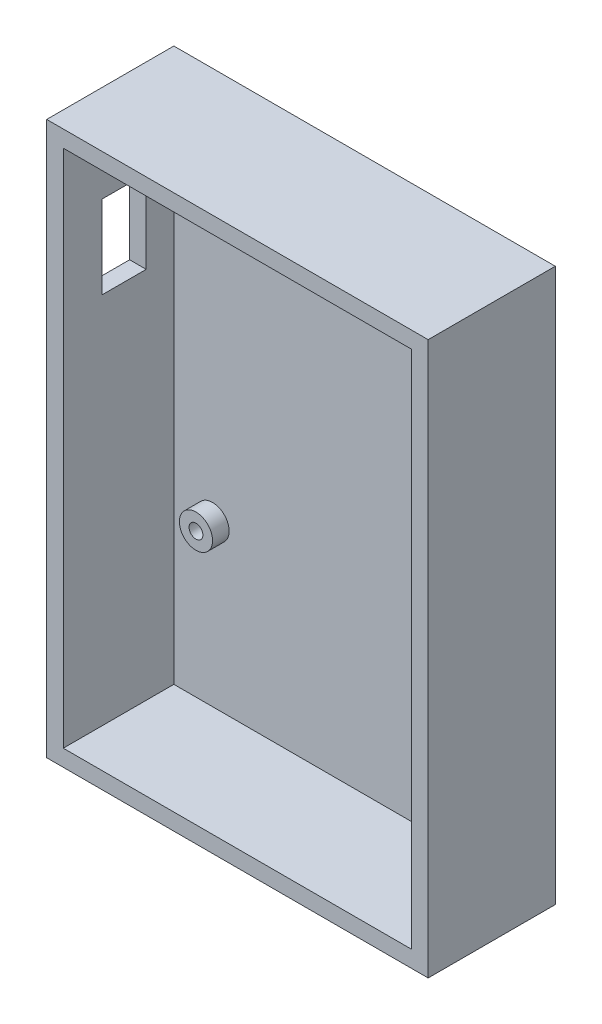
from build123d import *

# Parameters (mm, degrees)
IZIM1_W                     = 69
IZIM1_H                     = 100
IZIM1_R                     = 3
Y_KSEKLIK_EKSTR_ZYON1_DEPTH = 3
IZIM2_R                     = 3
IZIM2_R_2                   = 1.25
Y_KSEKLIK_EKSTR_ZYON2_DEPTH = 3
IZIM3_W                     = 69
IZIM3_H                     = 100
IZIM3_W_2                   = 63
IZIM3_H_2                   = 94
Y_KSEKLIK_EKSTR_ZYON3_DEPTH = 20
IZIM5_W                     = 8
IZIM5_H                     = 15
KES_EKSTR_ZYON1_DEPTH       = 10


with BuildPart() as part:
    # Çizim1 → Yükseklik-Ekstrüzyon1 (new body)
    with BuildSketch(Plane.XY):
        Rectangle(IZIM1_W, IZIM1_H)
        with Locations((0, 31.580483241)):
            Circle(IZIM1_R, mode=Mode.SUBTRACT)
    extrude(amount=Y_KSEKLIK_EKSTR_ZYON1_DEPTH)

    # Çizim2 → Yükseklik-Ekstrüzyon2 (add)
    # profile 1 of 4: a face of its own
    with BuildSketch(Plane.XY.offset(3)):
        with Locations((-24.5, 40)):
            Circle(IZIM2_R)
        with Locations((-24.5, 40)):
            Circle(IZIM2_R_2, mode=Mode.SUBTRACT)
    # profile 2 of 4: a face of its own
    with BuildSketch(Plane.XY.offset(3)):
        with Locations((24.5, 40)):
            Circle(IZIM2_R)
        with Locations((24.5, 40)):
            Circle(IZIM2_R_2, mode=Mode.SUBTRACT)
    # profile 3 of 4: a face of its own
    with BuildSketch(Plane.XY.offset(3)):
        with Locations((24.5, -18)):
            Circle(IZIM2_R)
        with Locations((24.5, -18)):
            Circle(IZIM2_R_2, mode=Mode.SUBTRACT)
    # profile 4 of 4: a face of its own
    with BuildSketch(Plane.XY.offset(3)):
        with Locations((-24.5, -18)):
            Circle(IZIM2_R)
        with Locations((-24.5, -18)):
            Circle(IZIM2_R_2, mode=Mode.SUBTRACT)
    extrude(amount=Y_KSEKLIK_EKSTR_ZYON2_DEPTH)

    # Çizim3 → Yükseklik-Ekstrüzyon3 (add)
    with BuildSketch(Plane.XY.offset(3)):
        Rectangle(IZIM3_W, IZIM3_H)
        Rectangle(IZIM3_W_2, IZIM3_H_2, mode=Mode.SUBTRACT)
    extrude(amount=Y_KSEKLIK_EKSTR_ZYON3_DEPTH)

    # Çizim5 → Kes-Ekstrüzyon1 (cut)
    with BuildSketch(Plane.ZY.offset(34.5)):
        with Locations((12, 28.01141751)):
            Rectangle(IZIM5_W, IZIM5_H)
    extrude(amount=-KES_EKSTR_ZYON1_DEPTH, mode=Mode.SUBTRACT)


solid = part.part
